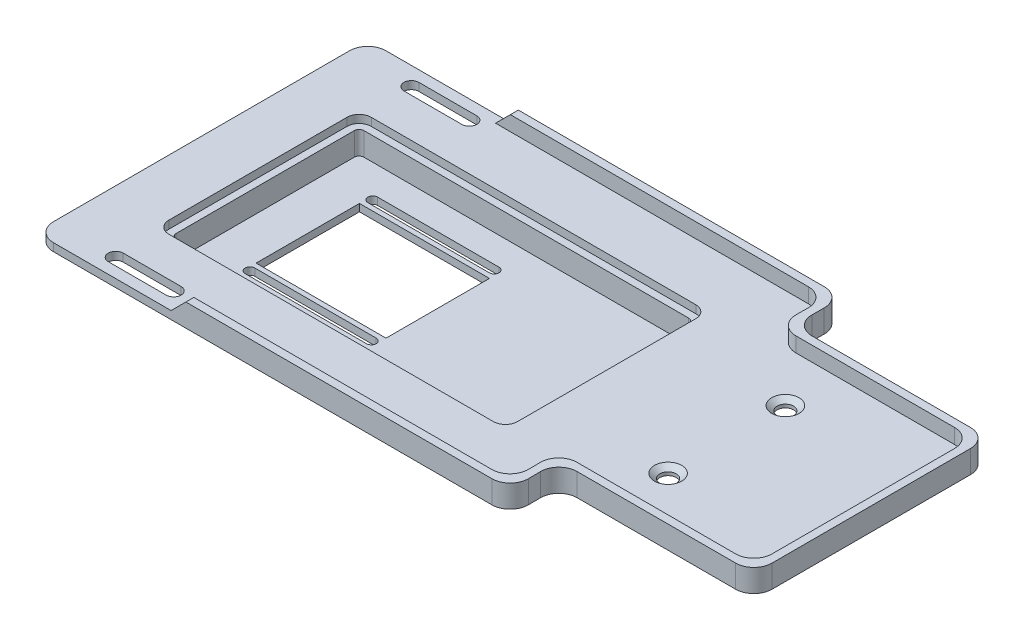
from build123d import *

# Parameters (mm, degrees)
SKETCH3_R                                 = 1.72085
BOSS_EXTRUDE3_DEPTH                       = 1.651
BOSS_EXTRUDE4_DEPTH                       = 4.7498
BOSS_EXTRUDE5_DEPTH                       = 6.35
SHELL1_T                                  = -1.524
SKETCH6_W                                 = 27.197772805
SKETCH6_H                                 = 21.6408
CUT_EXTRUDE1_DEPTH                        = 6.35
CSK_FOR_4_FLAT_HEAD_MACHINE_SCREW_2_COUNT = 2
CSK_FOR_4_FLAT_HEAD_MACHINE_SCREW_2_PITCH = 24.5491
CHAMFER2_SIZE                             = 4.92


with BuildPart() as part:
    # Sketch3 → Boss-Extrude3 (new body)
    with BuildSketch(Plane(origin=(0, 0, 0), x_dir=(1, 0, 0), z_dir=(0, 1, 0))):
        with BuildLine():
            Line((14.778331881, 64.196901379), (14.778331881, 65.860601379))
            Line((14.778331881, 65.860601379), (-8.005468119, 65.860601379))
            ThreePointArc((-8.005468119, 65.860601379), (-10.699544955, 64.744678215), (-11.815468119, 62.050601379))
            Line((-11.815468119, 62.050601379), (-11.815468119, 0.094456509))
            ThreePointArc((-11.815468119, 0.094456509), (-10.699544955, -2.599620328), (-8.005468119, -3.715543491))
            Line((-8.005468119, -3.715543491), (14.778331881, -3.715543491))
            Line((14.778331881, -3.715543491), (14.778331881, -2.051843491))
            Line((14.778331881, -2.051843491), (82.074957291, -2.051843491))
            ThreePointArc((82.074957291, -2.051843491), (84.782471003, -0.922416098), (85.884766787, 1.796256509))
            Line((85.884766787, 1.796256509), (85.859622964, 4.310513079))
            ThreePointArc((85.859622964, 4.310513079), (86.961918747, 7.029185686), (89.669432459, 8.158613079))
            Line((89.669432459, 8.158613079), (122.880731881, 8.158613079))
            ThreePointArc((122.880731881, 8.158613079), (125.574808718, 9.274536243), (126.690731881, 11.968613079))
            Line((126.690731881, 11.968613079), (126.690731881, 50.176444808))
            ThreePointArc((126.690731881, 50.176444808), (125.574808718, 52.870521644), (122.880731881, 53.986444808))
            Line((122.880731881, 53.986444808), (89.669432459, 53.986444808))
            ThreePointArc((89.669432459, 53.986444808), (86.961918747, 55.115872201), (85.859622964, 57.834544808))
            Line((85.859622964, 57.834544808), (85.884766787, 60.348801379))
            ThreePointArc((85.884766787, 60.348801379), (84.782471003, 63.067473985), (82.074957291, 64.196901379))
            Line((82.074957291, 64.196901379), (14.778331881, 64.196901379))
        make_face()
        with BuildLine():
            ThreePointArc((1.176631881, -1.429543491), (-0.385468119, 0.132556509), (1.176631881, 1.694656509))
            Line((1.176631881, 1.694656509), (13.292431881, 1.694656509))
            ThreePointArc((13.292431881, 1.694656509), (14.854531881, 0.132556509), (13.292431881, -1.429543491))
            Line((13.292431881, -1.429543491), (1.176631881, -1.429543491))
        make_face(mode=Mode.SUBTRACT)
        with BuildLine():
            ThreePointArc((-0.017168119, 49.718901379), (0.726780657, 51.514952603), (2.522831881, 52.258901379))
            Line((2.522831881, 52.258901379), (70.442431881, 52.258901379))
            ThreePointArc((70.442431881, 52.258901379), (72.238483106, 51.514952603), (72.982431881, 49.718901379))
            Line((72.982431881, 49.718901379), (72.982431881, 12.426156509))
            ThreePointArc((72.982431881, 12.426156509), (72.238483106, 10.630105284), (70.442431881, 9.886156509))
            Line((70.442431881, 9.886156509), (2.522831881, 9.886156509))
            ThreePointArc((2.522831881, 9.886156509), (0.726780657, 10.630105284), (-0.017168119, 12.426156509))
            Line((-0.017168119, 12.426156509), (-0.017168119, 49.718901379))
        make_face(mode=Mode.SUBTRACT)
        with Locations(Location((98.103031881, 18.797978944, 0), (0, 0, 90))):
            Circle(SKETCH3_R, mode=Mode.SUBTRACT)
        with BuildLine():
            ThreePointArc((1.176631881, 60.450401379), (-0.385468119, 62.012501379), (1.176631881, 63.574601379))
            Line((1.176631881, 63.574601379), (13.292431881, 63.574601379))
            ThreePointArc((13.292431881, 63.574601379), (14.854531881, 62.012501379), (13.292431881, 60.450401379))
            Line((13.292431881, 60.450401379), (1.176631881, 60.450401379))
        make_face(mode=Mode.SUBTRACT)
        with Locations(Location((98.103031881, 43.347078944, 0), (0, 0, 90))):
            Circle(SKETCH3_R, mode=Mode.SUBTRACT)
    extrude(amount=BOSS_EXTRUDE3_DEPTH)

    # Sketch3<4> → Boss-Extrude4 (add)
    with BuildSketch(Plane(origin=(0, 0, 0), x_dir=(1, 0, 0), z_dir=(0, 1, 0))):
        with BuildLine():
            Line((87.540043987, 59.498244808), (87.56518781, 62.012501379))
            ThreePointArc((87.56518781, 62.012501379), (86.462892026, 64.731173985), (83.755378315, 65.860601379))
            Line((83.755378315, 65.860601379), (14.778331881, 65.860601379))
            Line((14.778331881, 65.860601379), (14.778331881, 64.196901379))
            Line((14.778331881, 64.196901379), (82.074957291, 64.196901379))
            ThreePointArc((82.074957291, 64.196901379), (84.782471003, 63.067473985), (85.884766787, 60.348801379))
            Line((85.884766787, 60.348801379), (85.859622964, 57.834544808))
            ThreePointArc((85.859622964, 57.834544808), (86.961918747, 55.115872201), (89.669432459, 53.986444808))
            Line((89.669432459, 53.986444808), (122.880731881, 53.986444808))
            ThreePointArc((122.880731881, 53.986444808), (125.574808718, 52.870521644), (126.690731881, 50.176444808))
            Line((126.690731881, 50.176444808), (126.690731881, 11.968613079))
            ThreePointArc((126.690731881, 11.968613079), (125.574808718, 9.274536243), (122.880731881, 8.158613079))
            Line((122.880731881, 8.158613079), (89.669432459, 8.158613079))
            ThreePointArc((89.669432459, 8.158613079), (86.961918747, 7.029185686), (85.859622964, 4.310513079))
            Line((85.859622964, 4.310513079), (85.884766787, 1.796256509))
            ThreePointArc((85.884766787, 1.796256509), (84.782471003, -0.922416098), (82.074957291, -2.051843491))
            Line((82.074957291, -2.051843491), (14.778331881, -2.051843491))
            Line((14.778331881, -2.051843491), (14.778331881, -3.715543491))
            Line((14.778331881, -3.715543491), (83.755378315, -3.715543491))
            ThreePointArc((83.755378315, -3.715543491), (86.462892026, -2.586116098), (87.56518781, 0.132556509))
            Line((87.56518781, 0.132556509), (87.540043987, 2.646813079))
            ThreePointArc((87.540043987, 2.646813079), (88.64233977, 5.365485686), (91.349853482, 6.494913079))
            Line((91.349853482, 6.494913079), (124.544431881, 6.494913079))
            ThreePointArc((124.544431881, 6.494913079), (127.238508718, 7.610836243), (128.354431881, 10.304913079))
            Line((128.354431881, 10.304913079), (128.354431881, 51.840144808))
            ThreePointArc((128.354431881, 51.840144808), (127.238508718, 54.534221644), (124.544431881, 55.650144808))
            Line((124.544431881, 55.650144808), (91.349853482, 55.650144808))
            ThreePointArc((91.349853482, 55.650144808), (88.64233977, 56.779572201), (87.540043987, 59.498244808))
        make_face()
    extrude(amount=BOSS_EXTRUDE4_DEPTH)

    # Sketch9 → CSK for #4 Flat Head Machine Screw (100)1 (revolve, cut)
    with BuildSketch(Plane(origin=(98.103031881, 1.651, -43.347078944), x_dir=(0, 0, 1), z_dir=(1, 0, 0))):
        Polygon((0, 0), (0, 8.001), (1.63195, 8.001), (1.63195, 1.028358553), (2.8575, 0), align=None)
    csk_for_4_flat_head_machine_screw_100 = revolve(axis=Axis((98.103031881, 8.001, -43.347078944), (0, -1, 0)), mode=Mode.SUBTRACT)

    # CSK for _4 Flat Head Machine Screw _ 2: CSK for #4 Flat Head Machine Screw (100)1 ×2
    with Locations(*[(0, 0, i * CSK_FOR_4_FLAT_HEAD_MACHINE_SCREW_2_PITCH) for i in range(1, CSK_FOR_4_FLAT_HEAD_MACHINE_SCREW_2_COUNT)]):
        add(csk_for_4_flat_head_machine_screw_100, mode=Mode.SUBTRACT)

    # Chamfer2
    # the kernel refuses this chamfer: 4.92 mm, written as the material it takes off along each edge
    with BuildSketch(Plane(origin=(14.778331881, 4.7498, -10.600836809), x_dir=(0.9996219169112966, 0.027495876610586407, 0), z_dir=(0, 0, 1))) as chamfer2_piece_1_section:
        Polygon((CHAMFER2_SIZE * 0.999621916911, -CHAMFER2_SIZE * 0.0274958766106), (-CHAMFER2_SIZE * 0.0274958766106, -CHAMFER2_SIZE * 0.999621916911), (0, 0), align=None)
    chamfer2_piece_1 = extrude(amount=26.969060602, mode=Mode.PRIVATE)
    chamfer2_piece_1 = split(chamfer2_piece_1, bisect_by=Plane(origin=(16.59853765, 1.651, 2.883693491), z_dir=(0, 1, 0)), keep=Keep.TOP, mode=Mode.PRIVATE)
    add(chamfer2_piece_1, mode=Mode.SUBTRACT)
    with BuildSketch(Plane(origin=(14.778331881, 4.7498, -78.513281679), x_dir=(0.9996219169112966, 0.027495876610586407, 0), z_dir=(0, 0, 1))) as chamfer2_piece_2_section:
        Polygon((CHAMFER2_SIZE * 0.999621916911, -CHAMFER2_SIZE * 0.0274958766106), (-CHAMFER2_SIZE * 0.0274958766106, -CHAMFER2_SIZE * 0.999621916911), (0, 0), align=None)
    chamfer2_piece_2 = extrude(amount=26.969060602, mode=Mode.PRIVATE)
    chamfer2_piece_2 = split(chamfer2_piece_2, bisect_by=Plane(origin=(16.59853765, 1.651, -65.028751379), z_dir=(0, 1, 0)), keep=Keep.TOP, mode=Mode.PRIVATE)
    add(chamfer2_piece_2, mode=Mode.SUBTRACT)


with BuildPart() as body_2:
    # Sketch3<5> → Boss-Extrude5 (new body)
    with BuildSketch(Plane(origin=(0, 0, 0), x_dir=(1, 0, 0), z_dir=(0, 1, 0))):
        with BuildLine():
            ThreePointArc((-0.017168119, 49.718901379), (0.726780657, 51.514952603), (2.522831881, 52.258901379))
            Line((2.522831881, 52.258901379), (70.442431881, 52.258901379))
            ThreePointArc((70.442431881, 52.258901379), (72.238483106, 51.514952603), (72.982431881, 49.718901379))
            Line((72.982431881, 49.718901379), (72.982431881, 12.426156509))
            ThreePointArc((72.982431881, 12.426156509), (72.238483106, 10.630105284), (70.442431881, 9.886156509))
            Line((70.442431881, 9.886156509), (2.522831881, 9.886156509))
            ThreePointArc((2.522831881, 9.886156509), (0.726780657, 10.630105284), (-0.017168119, 12.426156509))
            Line((-0.017168119, 12.426156509), (-0.017168119, 49.718901379))
        make_face()
    extrude(amount=-BOSS_EXTRUDE5_DEPTH)

    # Shell1
    shell1_openings = [body_2.faces().sort_by_distance(p)[0] for p in [
        (36.482631881, 0, -31.072528944),
    ]]
    offset(amount=SHELL1_T, openings=shell1_openings, kind=Kind.INTERSECTION)

    # Sketch6 → Cut-Extrude1 (cut)
    with BuildSketch(Plane(origin=(0, -4.826, 0), x_dir=(1, 0, 0), z_dir=(0, 1, 0))):
        with BuildLine():
            Line((11.181733129, 44.940928944), (36.581733129, 44.940928944))
            ThreePointArc((36.581733129, 44.940928944), (37.597733129, 43.924928944), (36.581733129, 42.908928944))
            Line((36.581733129, 42.908928944), (11.181733129, 42.908928944))
            ThreePointArc((11.181733129, 42.908928944), (10.165733129, 43.924928944), (11.181733129, 44.940928944))
        make_face()
        with BuildLine():
            Line((11.181733129, 19.236128944), (36.581733129, 19.236128944))
            ThreePointArc((36.581733129, 19.236128944), (37.597733129, 18.220128944), (36.581733129, 17.204128944))
            Line((36.581733129, 17.204128944), (11.181733129, 17.204128944))
            ThreePointArc((11.181733129, 17.204128944), (10.165733129, 18.220128944), (11.181733129, 19.236128944))
        make_face()
        with Locations((24.018619532, 31.072528944)):
            Rectangle(SKETCH6_W, SKETCH6_H)
    extrude(amount=-CUT_EXTRUDE1_DEPTH, mode=Mode.SUBTRACT)


solid = Compound([part.part, body_2.part])
